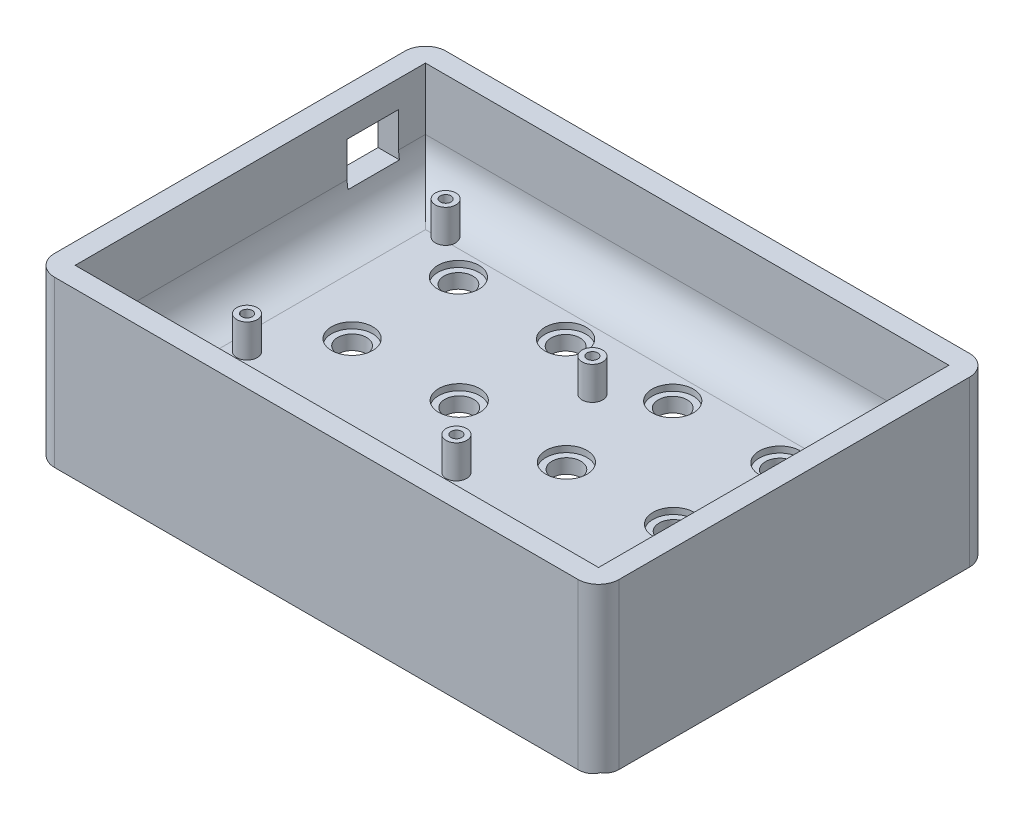
from build123d import *

# Parameters (mm, degrees)
SKETCH1_W           = 137
SKETCH1_H           = 95
SKETCH1_W_2         = 128.5
SKETCH1_H_2         = 85.563129374
BOSS_EXTRUDE1_DEPTH = 10
SKETCH2_W           = 137
SKETCH2_H           = 95
BOSS_EXTRUDE2_DEPTH = 30
SHELL1_T            = -5
SKETCH3_R           = 5
SKETCH3_R_2         = 4.75
CUT_EXTRUDE1_DEPTH  = 1.5
CUT_EXTRUDE2_REACH  = 89.469
SKETCH5_R           = 3.5
SKETCH7_R           = 2.5
SKETCH7_R_2         = 1.3
BOSS_EXTRUDE5_DEPTH = 8
SKETCH9_W           = 12.5
SKETCH9_H           = 10.5
CUT_EXTRUDE3_DEPTH  = 8
FILLET1_R           = 5
FILLET2_R           = 10


with BuildPart() as part:
    # Sketch1 → Boss-Extrude1 (new body)
    with BuildSketch(Plane(origin=(0, 0, 0), x_dir=(1, 0, 0), z_dir=(0, 1, 0))):
        Rectangle(SKETCH1_W, SKETCH1_H)
        Rectangle(SKETCH1_W_2, SKETCH1_H_2, mode=Mode.SUBTRACT)
    extrude(amount=BOSS_EXTRUDE1_DEPTH)

    # Sketch2 → Boss-Extrude2 (add)
    with BuildSketch(Plane(origin=(0, 10, 0), x_dir=(1, 0, 0), z_dir=(0, 1, 0))):
        Rectangle(SKETCH2_W, SKETCH2_H)
    extrude(amount=BOSS_EXTRUDE2_DEPTH)

    # Shell1
    shell1_openings = [part.faces().sort_by_distance(p)[0] for p in [
        (0, 40, 0),
    ]]
    offset(amount=SHELL1_T, openings=shell1_openings)

    # Sketch3 → Cut-Extrude1 (cut)
    with BuildSketch(Plane(origin=(0, 15, 0), x_dir=(1, 0, 0), z_dir=(0, 1, 0))):
        with Locations(Location((-39.5, 26.5, 0), (0, 0, 270))):
            Circle(SKETCH3_R)
        with Locations(Location((-13.5, 26.5, 0), (0, 0, 270))):
            Circle(SKETCH3_R)
        with Locations(Location((38.5, 26.5, 0), (0, 0, 270))):
            Circle(SKETCH3_R)
        with Locations(Location((-39.5, 0.700544246, 0), (0, 0, 270))):
            Circle(SKETCH3_R)
        with Locations(Location((-13.5, 0.700544246, 0), (0, 0, 270))):
            Circle(SKETCH3_R)
        with Locations(Location((12.5, 26.5, 0), (0, 0, 270))):
            Circle(SKETCH3_R)
        with Locations(Location((12.5, 0.700544246, 0), (0, 0, 270))):
            Circle(SKETCH3_R)
        with Locations(Location((38.5, 0.700544246, 0), (0, 0, 270))):
            Circle(SKETCH3_R)
        with Locations(Location((-39.5, -25.299455754, 0), (0, 0, 270))):
            Circle(SKETCH3_R)
        with Locations(Location((-13.5, -25.299455754, 0), (0, 0, 270))):
            Circle(SKETCH3_R)
        with Locations(Location((12.5, -25.299455754, 0), (0, 0, 270))):
            Circle(SKETCH3_R)
        with Locations(Location((38.5, -25.299455754, 0), (0, 0, 270))):
            Circle(SKETCH3_R_2)
    extrude(amount=-CUT_EXTRUDE1_DEPTH, mode=Mode.SUBTRACT)

    # Sketch5 → Cut-Extrude2 (cut, up to next)
    with BuildSketch(Plane(origin=(0, 13.5, 0), x_dir=(1, 0, 0), z_dir=(0, 1, 0)), mode=Mode.PRIVATE) as cut_extrude2_sk1:
        with Locations(Location((-39.5, 26.5, 0), (0, 0, 270))):
            Circle(SKETCH5_R)
    cut_extrude2_tool1 = extrude(cut_extrude2_sk1.sketch, amount=-CUT_EXTRUDE2_REACH, mode=Mode.PRIVATE) & part.part
    # Sketch5 → Cut-Extrude2 (cut, up to next)
    with BuildSketch(Plane(origin=(0, 13.5, 0), x_dir=(1, 0, 0), z_dir=(0, 1, 0)), mode=Mode.PRIVATE) as cut_extrude2_sk2:
        with Locations(Location((12.5, -25.299455754, 0), (0, 0, 270))):
            Circle(SKETCH5_R)
    cut_extrude2_tool2 = extrude(cut_extrude2_sk2.sketch, amount=-CUT_EXTRUDE2_REACH, mode=Mode.PRIVATE) & part.part
    # Sketch5 → Cut-Extrude2 (cut, up to next)
    with BuildSketch(Plane(origin=(0, 13.5, 0), x_dir=(1, 0, 0), z_dir=(0, 1, 0)), mode=Mode.PRIVATE) as cut_extrude2_sk3:
        with Locations(Location((12.5, 26.5, 0), (0, 0, 270))):
            Circle(SKETCH5_R)
    cut_extrude2_tool3 = extrude(cut_extrude2_sk3.sketch, amount=-CUT_EXTRUDE2_REACH, mode=Mode.PRIVATE) & part.part
    # Sketch5 → Cut-Extrude2 (cut, up to next)
    with BuildSketch(Plane(origin=(0, 13.5, 0), x_dir=(1, 0, 0), z_dir=(0, 1, 0)), mode=Mode.PRIVATE) as cut_extrude2_sk4:
        with Locations(Location((-13.5, 0.700544246, 0), (0, 0, 270))):
            Circle(SKETCH5_R)
    cut_extrude2_tool4 = extrude(cut_extrude2_sk4.sketch, amount=-CUT_EXTRUDE2_REACH, mode=Mode.PRIVATE) & part.part
    # Sketch5 → Cut-Extrude2 (cut, up to next)
    with BuildSketch(Plane(origin=(0, 13.5, 0), x_dir=(1, 0, 0), z_dir=(0, 1, 0)), mode=Mode.PRIVATE) as cut_extrude2_sk5:
        with Locations(Location((12.5, 0.700544246, 0), (0, 0, 270))):
            Circle(SKETCH5_R)
    cut_extrude2_tool5 = extrude(cut_extrude2_sk5.sketch, amount=-CUT_EXTRUDE2_REACH, mode=Mode.PRIVATE) & part.part
    # Sketch5 → Cut-Extrude2 (cut, up to next)
    with BuildSketch(Plane(origin=(0, 13.5, 0), x_dir=(1, 0, 0), z_dir=(0, 1, 0)), mode=Mode.PRIVATE) as cut_extrude2_sk6:
        with Locations(Location((38.5, 26.5, 0), (0, 0, 270))):
            Circle(SKETCH5_R)
    cut_extrude2_tool6 = extrude(cut_extrude2_sk6.sketch, amount=-CUT_EXTRUDE2_REACH, mode=Mode.PRIVATE) & part.part
    # Sketch5 → Cut-Extrude2 (cut, up to next)
    with BuildSketch(Plane(origin=(0, 13.5, 0), x_dir=(1, 0, 0), z_dir=(0, 1, 0)), mode=Mode.PRIVATE) as cut_extrude2_sk7:
        with Locations(Location((38.5, 0.700544246, 0), (0, 0, 270))):
            Circle(SKETCH5_R)
    cut_extrude2_tool7 = extrude(cut_extrude2_sk7.sketch, amount=-CUT_EXTRUDE2_REACH, mode=Mode.PRIVATE) & part.part
    # Sketch5 → Cut-Extrude2 (cut, up to next)
    with BuildSketch(Plane(origin=(0, 13.5, 0), x_dir=(1, 0, 0), z_dir=(0, 1, 0)), mode=Mode.PRIVATE) as cut_extrude2_sk8:
        with Locations(Location((-39.5, 0.700544246, 0), (0, 0, 270))):
            Circle(SKETCH5_R)
    cut_extrude2_tool8 = extrude(cut_extrude2_sk8.sketch, amount=-CUT_EXTRUDE2_REACH, mode=Mode.PRIVATE) & part.part
    # Sketch5 → Cut-Extrude2 (cut, up to next)
    with BuildSketch(Plane(origin=(0, 13.5, 0), x_dir=(1, 0, 0), z_dir=(0, 1, 0)), mode=Mode.PRIVATE) as cut_extrude2_sk9:
        with Locations(Location((-39.5, -25.299455754, 0), (0, 0, 270))):
            Circle(SKETCH5_R)
    cut_extrude2_tool9 = extrude(cut_extrude2_sk9.sketch, amount=-CUT_EXTRUDE2_REACH, mode=Mode.PRIVATE) & part.part
    # Sketch5 → Cut-Extrude2 (cut, up to next)
    with BuildSketch(Plane(origin=(0, 13.5, 0), x_dir=(1, 0, 0), z_dir=(0, 1, 0)), mode=Mode.PRIVATE) as cut_extrude2_sk10:
        with Locations(Location((38.5, -25.299455754, 0), (0, 0, 270))):
            Circle(SKETCH5_R)
    cut_extrude2_tool10 = extrude(cut_extrude2_sk10.sketch, amount=-CUT_EXTRUDE2_REACH, mode=Mode.PRIVATE) & part.part
    # Sketch5 → Cut-Extrude2 (cut, up to next)
    with BuildSketch(Plane(origin=(0, 13.5, 0), x_dir=(1, 0, 0), z_dir=(0, 1, 0)), mode=Mode.PRIVATE) as cut_extrude2_sk11:
        with Locations(Location((-13.5, 26.5, 0), (0, 0, 270))):
            Circle(SKETCH5_R)
    cut_extrude2_tool11 = extrude(cut_extrude2_sk11.sketch, amount=-CUT_EXTRUDE2_REACH, mode=Mode.PRIVATE) & part.part
    # Sketch5 → Cut-Extrude2 (cut, up to next)
    with BuildSketch(Plane(origin=(0, 13.5, 0), x_dir=(1, 0, 0), z_dir=(0, 1, 0)), mode=Mode.PRIVATE) as cut_extrude2_sk12:
        with Locations(Location((-13.5, -25.299455754, 0), (0, 0, 270))):
            Circle(SKETCH5_R)
    cut_extrude2_tool12 = extrude(cut_extrude2_sk12.sketch, amount=-CUT_EXTRUDE2_REACH, mode=Mode.PRIVATE) & part.part
    add(cut_extrude2_tool1.solids().sort_by_distance((-39.5, 13.5, -26.5))[0], mode=Mode.SUBTRACT)
    add(cut_extrude2_tool2.solids().sort_by_distance((12.5, 13.5, 25.299456))[0], mode=Mode.SUBTRACT)
    add(cut_extrude2_tool3.solids().sort_by_distance((12.5, 13.5, -26.5))[0], mode=Mode.SUBTRACT)
    add(cut_extrude2_tool4.solids().sort_by_distance((-13.5, 13.5, -0.700544))[0], mode=Mode.SUBTRACT)
    add(cut_extrude2_tool5.solids().sort_by_distance((12.5, 13.5, -0.700544))[0], mode=Mode.SUBTRACT)
    add(cut_extrude2_tool6.solids().sort_by_distance((38.5, 13.5, -26.5))[0], mode=Mode.SUBTRACT)
    add(cut_extrude2_tool7.solids().sort_by_distance((38.5, 13.5, -0.700544))[0], mode=Mode.SUBTRACT)
    add(cut_extrude2_tool8.solids().sort_by_distance((-39.5, 13.5, -0.700544))[0], mode=Mode.SUBTRACT)
    add(cut_extrude2_tool9.solids().sort_by_distance((-39.5, 13.5, 25.299456))[0], mode=Mode.SUBTRACT)
    add(cut_extrude2_tool10.solids().sort_by_distance((38.5, 13.5, 25.299456))[0], mode=Mode.SUBTRACT)
    add(cut_extrude2_tool11.solids().sort_by_distance((-13.5, 13.5, -26.5))[0], mode=Mode.SUBTRACT)
    add(cut_extrude2_tool12.solids().sort_by_distance((-13.5, 13.5, 25.299456))[0], mode=Mode.SUBTRACT)

    # Sketch7 → Boss-Extrude5 (add)
    # profile 1 of 4: a face of its own
    with BuildSketch(Plane(origin=(0, 15, 0), x_dir=(1, 0, 0), z_dir=(0, 1, 0))):
        with Locations(Location((-49.5, 33.404372067, 0), (0, 0, 270))):
            Circle(SKETCH7_R)
        with Locations(Location((-49.5, 33.404372067, 0), (0, 0, 270))):
            Circle(SKETCH7_R_2, mode=Mode.SUBTRACT)
    # profile 2 of 4: a face of its own
    with BuildSketch(Plane(origin=(0, 15, 0), x_dir=(1, 0, 0), z_dir=(0, 1, 0))):
        with Locations(Location((-49.5, -14.795627933, 0), (0, 0, 270))):
            Circle(SKETCH7_R)
        with Locations(Location((-49.5, -14.795627933, 0), (0, 0, 270))):
            Circle(SKETCH7_R_2, mode=Mode.SUBTRACT)
    # profile 3 of 4: a face of its own
    with BuildSketch(Plane(origin=(0, 15, 0), x_dir=(1, 0, 0), z_dir=(0, 1, 0))):
        with Locations(Location((1.3, 18.204372067, 0), (0, 0, 270))):
            Circle(SKETCH7_R)
        with Locations(Location((1.3, 18.204372067, 0), (0, 0, 270))):
            Circle(SKETCH7_R_2, mode=Mode.SUBTRACT)
    # profile 4 of 4: a face of its own
    with BuildSketch(Plane(origin=(0, 15, 0), x_dir=(1, 0, 0), z_dir=(0, 1, 0))):
        with Locations(Location((1.3, -14.795627933, 0), (0, 0, 270))):
            Circle(SKETCH7_R)
        with Locations(Location((1.3, -14.795627933, 0), (0, 0, 270))):
            Circle(SKETCH7_R_2, mode=Mode.SUBTRACT)
    extrude(amount=BOSS_EXTRUDE5_DEPTH)

    # Sketch9 → Cut-Extrude3 (cut)
    with BuildSketch(Plane(origin=(-63.5, 0, 0), x_dir=(0, 0, -1), z_dir=(1, 0, 0))):
        with Locations((29.75, 28.25)):
            Rectangle(SKETCH9_W, SKETCH9_H)
    extrude(amount=-CUT_EXTRUDE3_DEPTH, mode=Mode.SUBTRACT)

    # Fillet1
    # the kernel refuses this fillet: 5 mm, written as the material it takes off along each edge
    with BuildSketch(Plane(origin=(-68.5, 52.5, -47.5), x_dir=(0, 0, 1), z_dir=(0, -1, 0)), Plane(origin=(68.5, -12.5, -47.5), x_dir=(0, 0, 1), z_dir=(0, 1, 0)), Plane(origin=(68.5, -12.5, 47.5), x_dir=(-1, 0, 0), z_dir=(0, 1, 0)), Plane(origin=(-68.5, 52.5, 47.5), x_dir=(1, 0, 0), z_dir=(0, -1, 0))) as fillet1_piece_1:
        with BuildLine():
            CenterArc((FILLET1_R, -FILLET1_R), FILLET1_R, 90, 90)
            Line((0, -FILLET1_R), (0, 0))
            Line((0, 0), (FILLET1_R, 0))
        make_face()
    extrude(amount=65, mode=Mode.SUBTRACT)
    with BuildSketch(Plane(origin=(64.25, 0, -42.781564687), x_dir=(0, 0, -1), z_dir=(-1, 0, 0)), Plane(origin=(-64.25, 0, 42.781564687), x_dir=(0, 0, 1), z_dir=(1, 0, 0))) as fillet1_piece_2:
        with BuildLine():
            CenterArc((FILLET1_R, -FILLET1_R), FILLET1_R, 90, 90)
            Line((0, -FILLET1_R), (0, 0))
            Line((0, 0), (FILLET1_R, 0))
        make_face()
    extrude(amount=128.5, mode=Mode.SUBTRACT)
    with BuildSketch(Plane(origin=(64.25, 0, 42.781564687), x_dir=(1, 0, 0), z_dir=(0, 0, -1)), Plane(origin=(-64.25, 0, -42.781564687), x_dir=(-1, 0, 0), z_dir=(0, 0, 1))) as fillet1_piece_3:
        with BuildLine():
            CenterArc((FILLET1_R, -FILLET1_R), FILLET1_R, 90, 90)
            Line((0, -FILLET1_R), (0, 0))
            Line((0, 0), (FILLET1_R, 0))
        make_face()
    extrude(amount=85.563129375, mode=Mode.SUBTRACT)
    with BuildSketch(Plane(origin=(76.75, 0, -42.781564687), x_dir=(0, 0, -1), z_dir=(-1, 0, 0))) as fillet1_piece_4a_section:
        with BuildLine():
            CenterArc((FILLET1_R, -FILLET1_R), FILLET1_R, 90, 90)
            Line((0, -FILLET1_R), (0, 0))
            Line((0, 0), (FILLET1_R, 0))
        make_face()
    fillet1_piece_4a = extrude(amount=141, mode=Mode.PRIVATE)
    fillet1_piece_4a = split(fillet1_piece_4a, bisect_by=Plane(origin=(68.5, 0, -42.781564687), z_dir=(-1, 0, 0)), keep=Keep.TOP, mode=Mode.PRIVATE)
    fillet1_piece_4a = split(fillet1_piece_4a, bisect_by=Plane(origin=(76.75, 0, -47.5), z_dir=(0, 0, 1)), keep=Keep.TOP, mode=Mode.PRIVATE)
    fillet1_piece_4a = split(fillet1_piece_4a, bisect_by=Plane(origin=(64.25, 0, -42.781564687), z_dir=(1, 0, 0)), keep=Keep.TOP, mode=Mode.PRIVATE)
    with BuildSketch(Plane(origin=(64.25, 0, 42.781564687), x_dir=(1, 0, 0), z_dir=(0, 0, -1))) as fillet1_piece_4b_section:
        with BuildLine():
            CenterArc((FILLET1_R, -FILLET1_R), FILLET1_R, 90, 90)
            Line((0, -FILLET1_R), (0, 0))
            Line((0, 0), (FILLET1_R, 0))
        make_face()
    fillet1_piece_4b = extrude(amount=98.063129375, mode=Mode.PRIVATE)
    fillet1_piece_4b = split(fillet1_piece_4b, bisect_by=Plane(origin=(68.5, 0, 42.781564687), z_dir=(-1, 0, 0)), keep=Keep.TOP, mode=Mode.PRIVATE)
    fillet1_piece_4b = split(fillet1_piece_4b, bisect_by=Plane(origin=(64.25, 0, -47.5), z_dir=(0, 0, 1)), keep=Keep.TOP, mode=Mode.PRIVATE)
    fillet1_piece_4b = split(fillet1_piece_4b, bisect_by=Plane(origin=(64.25, 0, -42.781564687), z_dir=(0, 0, -1)), keep=Keep.TOP, mode=Mode.PRIVATE)
    fillet1_piece_4 = fillet1_piece_4a & fillet1_piece_4b
    add(fillet1_piece_4, mode=Mode.SUBTRACT)
    with BuildSketch(Plane(origin=(-64.25, 0, -55.281564687), x_dir=(-1, 0, 0), z_dir=(0, 0, 1))) as fillet1_piece_5a_section:
        with BuildLine():
            CenterArc((FILLET1_R, -FILLET1_R), FILLET1_R, 90, 90)
            Line((0, -FILLET1_R), (0, 0))
            Line((0, 0), (FILLET1_R, 0))
        make_face()
    fillet1_piece_5a = extrude(amount=98.063129375, mode=Mode.PRIVATE)
    fillet1_piece_5a = split(fillet1_piece_5a, bisect_by=Plane(origin=(-68.5, 0, -55.281564687), z_dir=(1, 0, 0)), keep=Keep.TOP, mode=Mode.PRIVATE)
    fillet1_piece_5a = split(fillet1_piece_5a, bisect_by=Plane(origin=(-64.25, 0, -47.5), z_dir=(0, 0, 1)), keep=Keep.TOP, mode=Mode.PRIVATE)
    fillet1_piece_5a = split(fillet1_piece_5a, bisect_by=Plane(origin=(-64.25, 0, -42.781564687), z_dir=(0, 0, -1)), keep=Keep.TOP, mode=Mode.PRIVATE)
    with BuildSketch(Plane(origin=(64.25, 0, -42.781564687), x_dir=(0, 0, -1), z_dir=(-1, 0, 0))) as fillet1_piece_5b_section:
        with BuildLine():
            CenterArc((FILLET1_R, -FILLET1_R), FILLET1_R, 90, 90)
            Line((0, -FILLET1_R), (0, 0))
            Line((0, 0), (FILLET1_R, 0))
        make_face()
    fillet1_piece_5b = extrude(amount=141, mode=Mode.PRIVATE)
    fillet1_piece_5b = split(fillet1_piece_5b, bisect_by=Plane(origin=(-68.5, 0, -42.781564687), z_dir=(1, 0, 0)), keep=Keep.TOP, mode=Mode.PRIVATE)
    fillet1_piece_5b = split(fillet1_piece_5b, bisect_by=Plane(origin=(64.25, 0, -47.5), z_dir=(0, 0, 1)), keep=Keep.TOP, mode=Mode.PRIVATE)
    fillet1_piece_5b = split(fillet1_piece_5b, bisect_by=Plane(origin=(-64.25, 0, -42.781564687), z_dir=(-1, 0, 0)), keep=Keep.TOP, mode=Mode.PRIVATE)
    fillet1_piece_5 = fillet1_piece_5a & fillet1_piece_5b
    add(fillet1_piece_5, mode=Mode.SUBTRACT)
    with BuildSketch(Plane(origin=(64.25, 0, 55.281564687), x_dir=(1, 0, 0), z_dir=(0, 0, -1))) as fillet1_piece_6a_section:
        with BuildLine():
            CenterArc((FILLET1_R, -FILLET1_R), FILLET1_R, 90, 90)
            Line((0, -FILLET1_R), (0, 0))
            Line((0, 0), (FILLET1_R, 0))
        make_face()
    fillet1_piece_6a = extrude(amount=98.063129375, mode=Mode.PRIVATE)
    fillet1_piece_6a = split(fillet1_piece_6a, bisect_by=Plane(origin=(64.25, 0, 47.5), z_dir=(0, 0, -1)), keep=Keep.TOP, mode=Mode.PRIVATE)
    fillet1_piece_6a = split(fillet1_piece_6a, bisect_by=Plane(origin=(68.5, 0, 55.281564687), z_dir=(-1, 0, 0)), keep=Keep.TOP, mode=Mode.PRIVATE)
    fillet1_piece_6a = split(fillet1_piece_6a, bisect_by=Plane(origin=(64.25, 0, 42.781564687), z_dir=(0, 0, 1)), keep=Keep.TOP, mode=Mode.PRIVATE)
    with BuildSketch(Plane(origin=(-64.25, 0, 42.781564687), x_dir=(0, 0, 1), z_dir=(1, 0, 0))) as fillet1_piece_6b_section:
        with BuildLine():
            CenterArc((FILLET1_R, -FILLET1_R), FILLET1_R, 90, 90)
            Line((0, -FILLET1_R), (0, 0))
            Line((0, 0), (FILLET1_R, 0))
        make_face()
    fillet1_piece_6b = extrude(amount=141, mode=Mode.PRIVATE)
    fillet1_piece_6b = split(fillet1_piece_6b, bisect_by=Plane(origin=(-64.25, 0, 47.5), z_dir=(0, 0, -1)), keep=Keep.TOP, mode=Mode.PRIVATE)
    fillet1_piece_6b = split(fillet1_piece_6b, bisect_by=Plane(origin=(68.5, 0, 42.781564687), z_dir=(-1, 0, 0)), keep=Keep.TOP, mode=Mode.PRIVATE)
    fillet1_piece_6b = split(fillet1_piece_6b, bisect_by=Plane(origin=(64.25, 0, 42.781564687), z_dir=(1, 0, 0)), keep=Keep.TOP, mode=Mode.PRIVATE)
    fillet1_piece_6 = fillet1_piece_6a & fillet1_piece_6b
    add(fillet1_piece_6, mode=Mode.SUBTRACT)
    with BuildSketch(Plane(origin=(-64.25, 0, -42.781564687), x_dir=(-1, 0, 0), z_dir=(0, 0, 1))) as fillet1_piece_7a_section:
        with BuildLine():
            CenterArc((FILLET1_R, -FILLET1_R), FILLET1_R, 90, 90)
            Line((0, -FILLET1_R), (0, 0))
            Line((0, 0), (FILLET1_R, 0))
        make_face()
    fillet1_piece_7a = extrude(amount=98.063129375, mode=Mode.PRIVATE)
    fillet1_piece_7a = split(fillet1_piece_7a, bisect_by=Plane(origin=(-64.25, 0, 47.5), z_dir=(0, 0, -1)), keep=Keep.TOP, mode=Mode.PRIVATE)
    fillet1_piece_7a = split(fillet1_piece_7a, bisect_by=Plane(origin=(-68.5, 0, -42.781564687), z_dir=(1, 0, 0)), keep=Keep.TOP, mode=Mode.PRIVATE)
    fillet1_piece_7a = split(fillet1_piece_7a, bisect_by=Plane(origin=(-64.25, 0, 42.781564687), z_dir=(0, 0, 1)), keep=Keep.TOP, mode=Mode.PRIVATE)
    with BuildSketch(Plane(origin=(-76.75, 0, 42.781564687), x_dir=(0, 0, 1), z_dir=(1, 0, 0))) as fillet1_piece_7b_section:
        with BuildLine():
            CenterArc((FILLET1_R, -FILLET1_R), FILLET1_R, 90, 90)
            Line((0, -FILLET1_R), (0, 0))
            Line((0, 0), (FILLET1_R, 0))
        make_face()
    fillet1_piece_7b = extrude(amount=141, mode=Mode.PRIVATE)
    fillet1_piece_7b = split(fillet1_piece_7b, bisect_by=Plane(origin=(-76.75, 0, 47.5), z_dir=(0, 0, -1)), keep=Keep.TOP, mode=Mode.PRIVATE)
    fillet1_piece_7b = split(fillet1_piece_7b, bisect_by=Plane(origin=(-68.5, 0, 42.781564687), z_dir=(1, 0, 0)), keep=Keep.TOP, mode=Mode.PRIVATE)
    fillet1_piece_7b = split(fillet1_piece_7b, bisect_by=Plane(origin=(-64.25, 0, 42.781564687), z_dir=(-1, 0, 0)), keep=Keep.TOP, mode=Mode.PRIVATE)
    fillet1_piece_7 = fillet1_piece_7a & fillet1_piece_7b
    add(fillet1_piece_7, mode=Mode.SUBTRACT)

    # Fillet2
    # the kernel refuses this fillet: 10 mm, written as the material it adds along each edge
    with BuildSketch(Plane(origin=(63.5, 15, -42.5), x_dir=(0, 1, 0), z_dir=(0, 0, 1))) as fillet2_piece_1:
        with BuildLine():
            CenterArc((FILLET2_R, FILLET2_R), FILLET2_R, 180, 90)
            Line((0, FILLET2_R), (0, 0))
            Line((0, 0), (FILLET2_R, 0))
        make_face()
    extrude(amount=85)
    with BuildSketch(Plane(origin=(-63.5, 15, -42.5), x_dir=(0, 1, 0), z_dir=(1, 0, 0))) as fillet2_piece_2_section:
        with BuildLine():
            CenterArc((FILLET2_R, FILLET2_R), FILLET2_R, 180, 90)
            Line((0, FILLET2_R), (0, 0))
            Line((0, 0), (FILLET2_R, 0))
        make_face()
    fillet2_piece_2 = extrude(amount=127, mode=Mode.PRIVATE)
    fillet2_piece_2 = fillet2_piece_2 - Plane(origin=(-49.5, 15, -33.404372067), x_dir=(0, 0, 1), z_dir=(0, -1, 0)) * Cylinder(1.3, 294, mode=Mode.PRIVATE)
    add(fillet2_piece_2)
    with BuildSketch(Plane(origin=(-63.5, 15, 42.5), x_dir=(0, 1, 0), z_dir=(0, 0, -1))) as fillet2_piece_3_section:
        with BuildLine():
            CenterArc((FILLET2_R, FILLET2_R), FILLET2_R, 180, 90)
            Line((0, FILLET2_R), (0, 0))
            Line((0, 0), (FILLET2_R, 0))
        make_face()
    fillet2_piece_3 = extrude(amount=85, mode=Mode.PRIVATE)
    fillet2_piece_3 = fillet2_piece_3 - Plane(origin=(-63.5, 25, -32.5), x_dir=(0, 0, -1), z_dir=(-1, 0, 0)) * Cylinder(10, 210, mode=Mode.PRIVATE)
    add(fillet2_piece_3)
    with BuildSketch(Plane(origin=(-63.5, 15, 42.5), x_dir=(0, 1, 0), z_dir=(0, 0, -1))) as fillet2_piece_4_section:
        with BuildLine():
            CenterArc((FILLET2_R, FILLET2_R), FILLET2_R, 180, 90)
            Line((0, FILLET2_R), (0, 0))
            Line((0, 0), (FILLET2_R, 0))
        make_face()
    fillet2_piece_4 = extrude(amount=85, mode=Mode.PRIVATE)
    fillet2_piece_4 = split(fillet2_piece_4, bisect_by=Plane(origin=(-63.5, 23, 42.5), z_dir=(0, -1, 0)), keep=Keep.TOP, mode=Mode.PRIVATE)
    add(fillet2_piece_4)
    with BuildSketch(Plane(origin=(-63.5, 15, 42.5), x_dir=(0, 1, 0), z_dir=(0, 0, -1))) as fillet2_piece_5_section:
        with BuildLine():
            CenterArc((FILLET2_R, FILLET2_R), FILLET2_R, 180, 90)
            Line((0, FILLET2_R), (0, 0))
            Line((0, 0), (FILLET2_R, 0))
        make_face()
    fillet2_piece_5 = extrude(amount=110, mode=Mode.PRIVATE)
    fillet2_piece_5 = split(fillet2_piece_5, bisect_by=Plane(origin=(-63.5, 15, -23.5), z_dir=(0, 0, 1)), keep=Keep.TOP, mode=Mode.PRIVATE)
    add(fillet2_piece_5)
    with BuildSketch(Plane(origin=(-63.5, 15, 67.5), x_dir=(0, 1, 0), z_dir=(0, 0, -1))) as fillet2_piece_6_section:
        with BuildLine():
            CenterArc((FILLET2_R, FILLET2_R), FILLET2_R, 180, 90)
            Line((0, FILLET2_R), (0, 0))
            Line((0, 0), (FILLET2_R, 0))
        make_face()
    fillet2_piece_6 = extrude(amount=110, mode=Mode.PRIVATE)
    fillet2_piece_6 = split(fillet2_piece_6, bisect_by=Plane(origin=(-63.5, 15, -36), z_dir=(0, 0, -1)), keep=Keep.TOP, mode=Mode.PRIVATE)
    add(fillet2_piece_6)
    with BuildSketch(Plane(origin=(63.5, 15, 42.5), x_dir=(0, 1, 0), z_dir=(-1, 0, 0))) as fillet2_piece_7:
        with BuildLine():
            CenterArc((FILLET2_R, FILLET2_R), FILLET2_R, 180, 90)
            Line((0, FILLET2_R), (0, 0))
            Line((0, 0), (FILLET2_R, 0))
        make_face()
    extrude(amount=127)


solid = part.part
